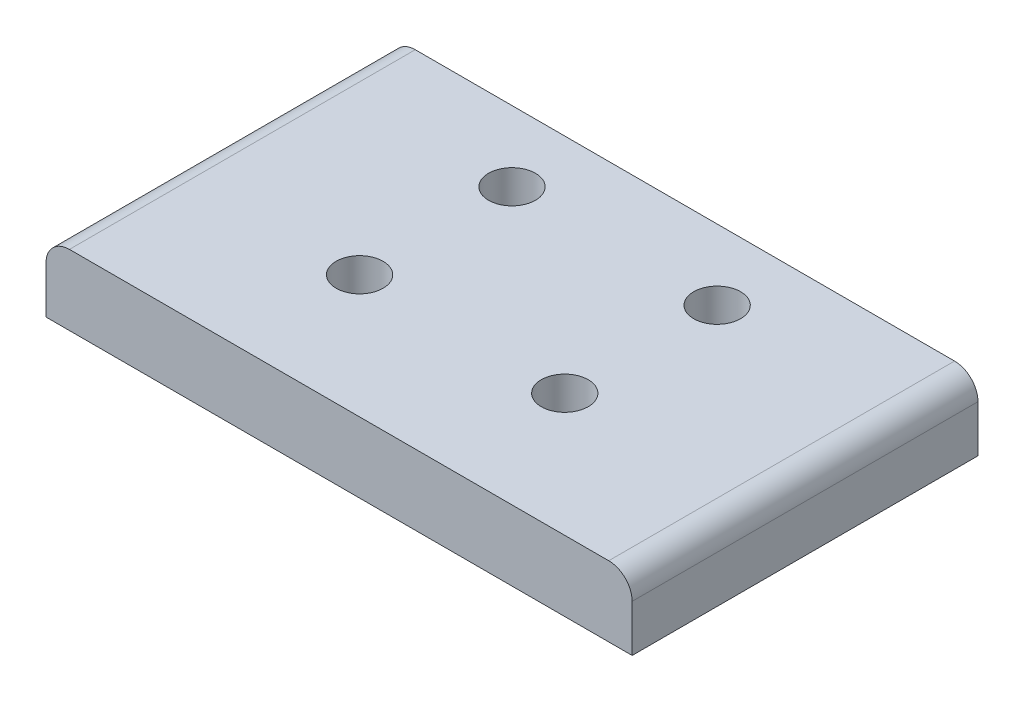
from build123d import *

# Parameters (mm, degrees)
SKETCH1_W             = 50
SKETCH1_H             = 29.5
BOSS_EXTRUDE1_DEPTH   = 6
FILLET1_R             = 2
FILLET2_R             = 2
F_4_0MM_DOWEL_HOLE2_D = 4


with BuildPart() as part:
    # Sketch1 → Boss-Extrude1 (new body)
    with BuildSketch(Plane(origin=(0, 0, 0), x_dir=(1, 0, 0), z_dir=(0, 1, 0))):
        with Locations((25, 14.75)):
            Rectangle(SKETCH1_W, SKETCH1_H)
    extrude(amount=BOSS_EXTRUDE1_DEPTH)

    # Fillet1
    fillet1_edges = [part.edges().sort_by_distance(p)[0] for p in [
        (0, 6, -14.75),
    ]]
    fillet(fillet1_edges, radius=FILLET1_R)

    # Fillet2
    fillet2_edges = [part.edges().sort_by_distance(p)[0] for p in [
        (50, 6, -14.75),
    ]]
    fillet(fillet2_edges, radius=FILLET2_R)

    # Ø4.0mm Dowel Hole2 (through all)
    with Locations(Plane(origin=(16.25, 0, -23.5), x_dir=(0, 0, -1), z_dir=(0, -1, 0))):
        with Locations((0, 0), (0, 17.5), (-13, 17.5), (-13, 0)):
            Hole(F_4_0MM_DOWEL_HOLE2_D / 2)


solid = part.part
